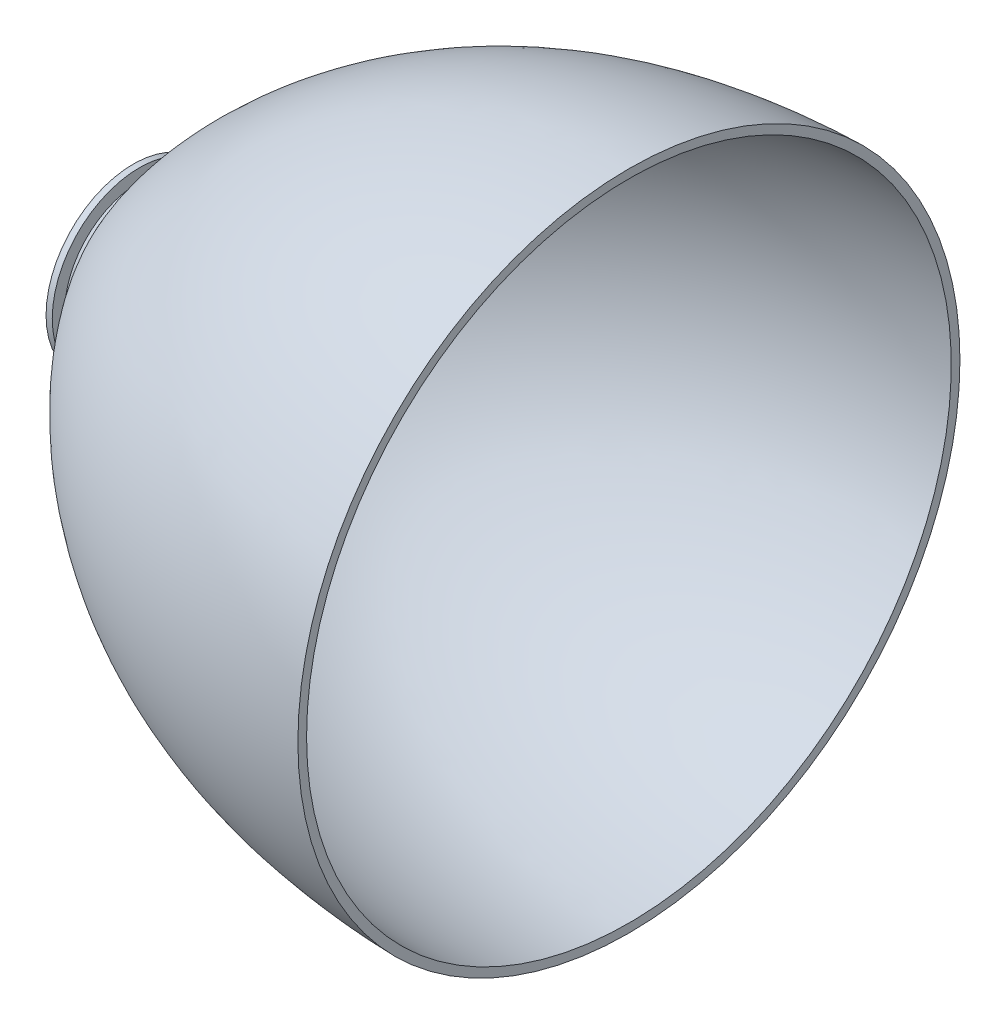
from build123d import *

# Parameters (mm, degrees)
SKETCH4_W           = 2299.140163329
SKETCH4_H           = 1084.867048291
CUT_EXTRUDE1_DEPTH  = 554.228
SKETCH5_R           = 89.428796415
SKETCH5_R_2         = 76.728796415
BOSS_EXTRUDE1_DEPTH = 6.35


with BuildPart() as part:
    # Sketch1 → Revolve3 (revolve)
    with BuildSketch(Plane.XY):
        with BuildLine():
            Line((500, 330.2), (500, 339.09))
            add(Edge.make_bspline(
                [(0, 72.39), (163.777283466, 330.523765378), (500, 339.09)],
                knots=[0, 0, 0, 1, 1, 1], degree=2))
            add(Edge.make_bspline(
                [(0, 72.39), (-189.353547542, 181.782792201), (-412.824178468, 153.699870936)],
                knots=[0, 0, 0, 1, 1, 1], degree=2))
            Line((-412.824178468, 153.699870936), (-412.824178468, 144.809870936))
            add(Edge.make_bspline(
                [(0, 63.5), (-192.283511437, 162.67820459), (-412.824178468, 144.809870936)],
                knots=[0, 0, 0, 1, 1, 1], degree=2))
            add(Edge.make_bspline(
                [(0, 63.5), (163.777283466, 321.633765378), (500, 330.2)],
                knots=[0, 0, 0, 1, 1, 1], degree=2))
        make_face()
    revolve(axis=Axis((-1229.828239288, 0, 0), (1, 0, 0)))

    # Sketch4 → Cut-Extrude1 (cut)
    with BuildSketch(Plane.ZY.offset(7.62)):
        with Locations((-63.658537287, 96.480710784)):
            Rectangle(SKETCH4_W, SKETCH4_H)
    extrude(amount=CUT_EXTRUDE1_DEPTH, mode=Mode.SUBTRACT)


with BuildPart() as body_2:
    # Sketch5 → Boss-Extrude1 (new body)
    with BuildSketch(Plane.ZY.offset(7.62)):
        Circle(SKETCH5_R)
        Circle(SKETCH5_R_2, mode=Mode.SUBTRACT)
    extrude(amount=-BOSS_EXTRUDE1_DEPTH)


solid = Compound([part.part, body_2.part])
